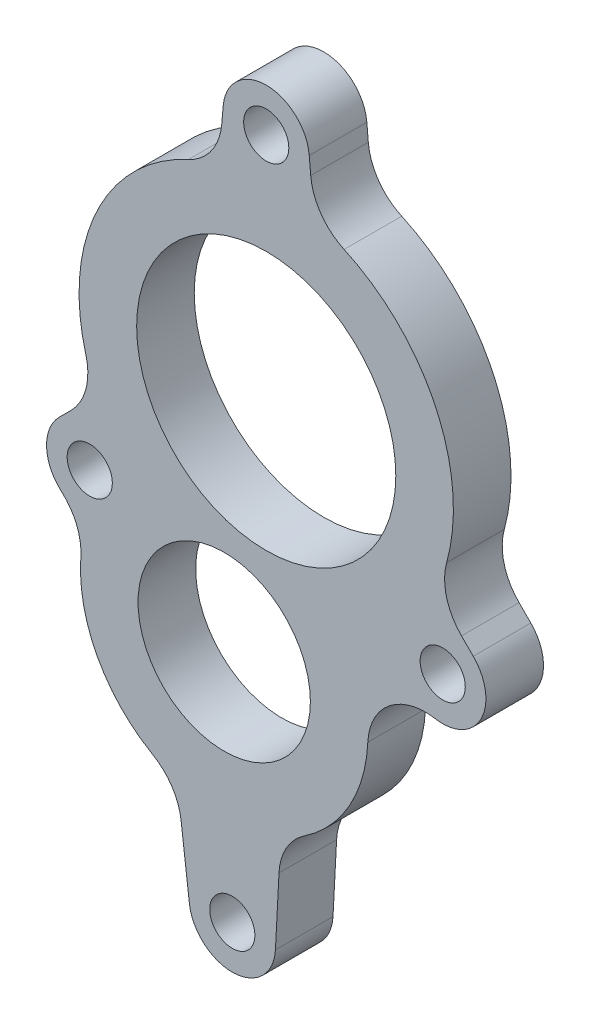
from build123d import *

# Parameters (mm, degrees)
SKETCH1_R               = 2.4892
SKETCH1_R_2             = 14.2875
BOSS_EXTRUDE1_DEPTH     = 3.175
SKETCH48_R              = 2.4892
BOSS_EXTRUDE2_DEPTH     = 3.175
CUT_EXTRUDE1_DEPTH      = 62.473150941
CUT_EXTRUDE1_DEPTH_BACK = 62.473150941
FILLET1_R               = 6.35


with BuildPart() as part:
    # Sketch1 → Boss-Extrude1 (new, symmetric)
    with BuildSketch(Plane.XY):
        with BuildLine():
            Line((-4.74437725, 25.815079225), (-5.256916026, 19.956734205))
            ThreePointArc((-5.256916026, 19.956734205), (-18.703926955, 8.721784377), (-18.666825827, -8.800910167))
            Line((-18.666825827, -8.800910167), (-22.825124901, -12.959209241))
            ThreePointArc((-22.825124901, -12.959209241), (-23.105815516, -19.388081277), (-16.725871077, -20.228016897))
            Line((-16.725871077, -20.228016897), (-11.908664854, -16.854972787))
            ThreePointArc((-11.908664854, -16.854972787), (0, -20.6375), (11.908664854, -16.854972787))
            Line((11.908664854, -16.854972787), (16.725871077, -20.228016897))
            ThreePointArc((16.725871077, -20.228016897), (23.105815516, -19.388081277), (22.825124901, -12.959209241))
            Line((22.825124901, -12.959209241), (18.666825827, -8.800910167))
            ThreePointArc((18.666825827, -8.800910167), (18.703926955, 8.721784377), (5.256916026, 19.956734205))
            Line((5.256916026, 19.956734205), (4.74437725, 25.815079225))
            ThreePointArc((4.74437725, 25.815079225), (0, 30.1625), (-4.74437725, 25.815079225))
        make_face()
        with Locations((0, 25.4)):
            Circle(SKETCH1_R, mode=Mode.SUBTRACT)
        Circle(SKETCH1_R_2, mode=Mode.SUBTRACT)
        with Locations((19.457528855, -16.326805286)):
            Circle(SKETCH1_R, mode=Mode.SUBTRACT)
        with Locations((-19.457528855, -16.326805286)):
            Circle(SKETCH1_R, mode=Mode.SUBTRACT)
    extrude(amount=BOSS_EXTRUDE1_DEPTH, both=True)

    # Sketch48 → Boss-Extrude2 (add, symmetric)
    with BuildSketch(Plane.XY):
        with BuildLine():
            Line((-9.819644584, -41.24132086), (-8.468509885, -52.230199896))
            ThreePointArc((-8.468509885, -52.230199896), (-3.574599444, -56.408575595), (1.014408673, -51.897457398))
            Line((1.014408673, -51.897457398), (1.591999565, -40.840902048))
            ThreePointArc((1.591999565, -40.840902048), (8.391952851, -35.296704242), (11.20091951, -26.984833193))
            ThreePointArc((11.20091951, -26.984833193), (13.570526935, -22.320484615), (18.637599513, -21.018193367))
            ThreePointArc((18.637599513, -21.018193367), (17.638315431, -20.728153803), (16.725871077, -20.228016897))
            Line((16.725871077, -20.228016897), (11.908664854, -16.854972787))
            ThreePointArc((11.908664854, -16.854972787), (10.574113603, -17.722712201), (9.17664996, -18.485007486))
            ThreePointArc((9.17664996, -18.485007486), (7.223303508, -15.745393142), (4.735670734, -13.479839723))
            ThreePointArc((4.735670734, -13.479839723), (-2.481594068, -14.070335715), (-9.061386986, -11.046443869))
            ThreePointArc((-9.061386986, -11.046443869), (-13.418778011, -13.073425768), (-16.968366207, -16.313168939))
            ThreePointArc((-16.968366207, -16.313168939), (-17.389893843, -17.712807486), (-18.524426322, -18.634495972))
            ThreePointArc((-18.524426322, -18.634495972), (-19.423303318, -31.959914639), (-9.819644584, -41.24132086))
        make_face()
        with Locations((-3.741606205, -51.649004712)):
            Circle(SKETCH48_R, mode=Mode.SUBTRACT)
        with BuildLine():
            ThreePointArc((-9.688105942, -18.222157103), (-2.982324604, -16.909416788), (2.869766316, -20.436997028))
            ThreePointArc((2.869766316, -20.436997028), (-6.282293249, -35.619836548), (-9.688105942, -18.222157103))
        make_face(mode=Mode.SUBTRACT)
    extrude(amount=BOSS_EXTRUDE2_DEPTH, both=True)

    # Sketch48<3> → Cut-Extrude1 (cut, two sides: drawn at the far end of the back side and taken through both)
    with BuildSketch(Plane.XY.offset(-CUT_EXTRUDE1_DEPTH_BACK)):
        with BuildLine():
            ThreePointArc((-9.688105942, -18.222157103), (-3.584524765, -20.323818255), (2.869766316, -20.436997028))
            ThreePointArc((2.869766316, -20.436997028), (-2.982324604, -16.909416788), (-9.688105942, -18.222157103))
        make_face()
    extrude(amount=CUT_EXTRUDE1_DEPTH + CUT_EXTRUDE1_DEPTH_BACK, mode=Mode.SUBTRACT)

    # Fillet1
    fillet1_edges = [part.edges().sort_by_distance(p)[0] for p in [
        (18.666825827, -8.800910167, 0),
        (-18.666825827, -8.800910167, 0),
        (-5.256916026, 19.956734205, 0),
        (5.256916026, 19.956734205, 0),
        (1.591999565, -40.840902048, 0),
        (-19.61228985, -21.086790085, 0),
        (-9.819644584, -41.24132086, 0),
    ]]
    fillet(fillet1_edges, radius=FILLET1_R)


solid = part.part
